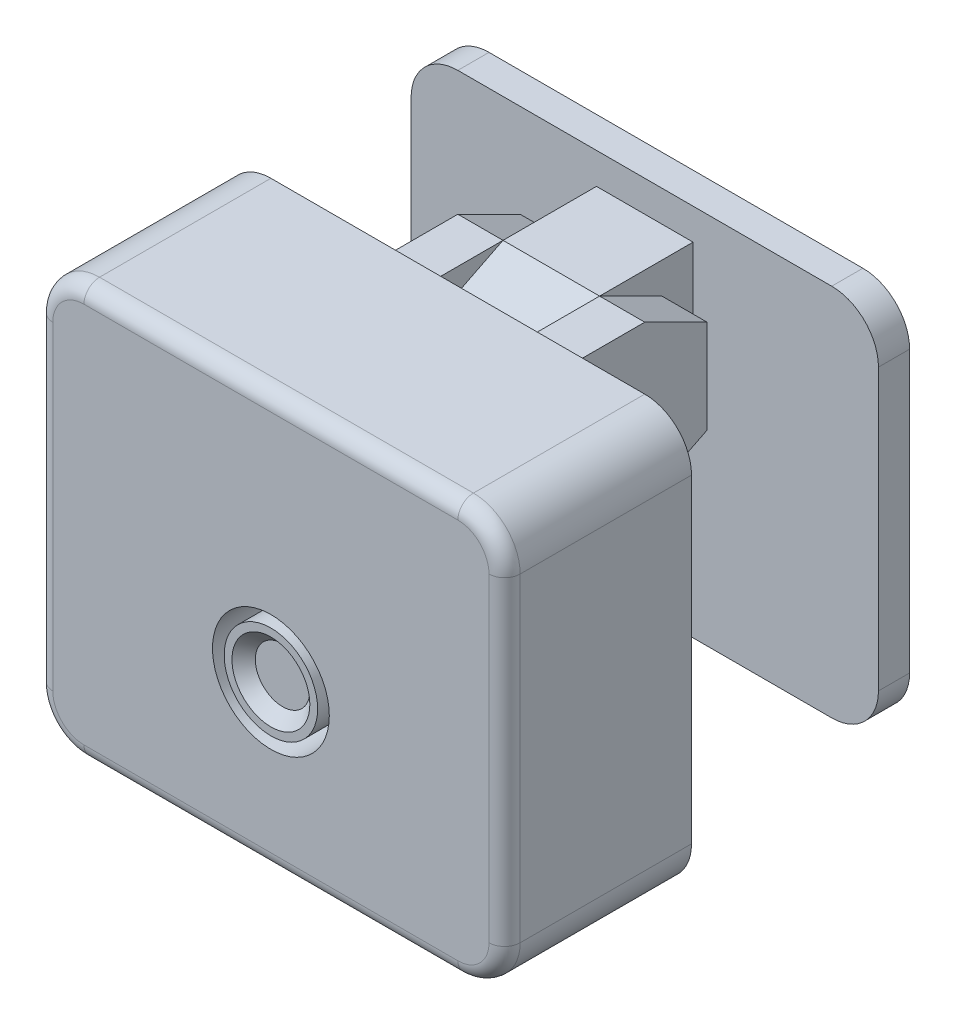
from build123d import *
from OCP.BRepFilletAPI import BRepFilletAPI_MakeChamfer

# Parameters (mm, degrees)
SKETCH1_W           = 30
SKETCH1_H           = 26.5
BOSS_EXTRUDE1_DEPTH = 12
FILLET1_R           = 3
FILLET2_R           = 1
SKETCH2_R           = 3.75
CUT_EXTRUDE1_DEPTH  = 5
SKETCH3_R           = 3
BOSS_EXTRUDE2_DEPTH = 5
SKETCH4_R           = 1.75
CUT_EXTRUDE2_DEPTH  = 0.75
CHAMFER1_SIZE       = 0.75
SKETCH5_W           = 2.9
SKETCH5_H           = 10
BOSS_EXTRUDE3_DEPTH = 10
CHAMFER2_SIZE       = 4
CHAMFER2_SIZE2      = 2
BOSS_EXTRUDE4_DEPTH = 6.2
SKETCH7_W           = 30
SKETCH7_H           = 24
BOSS_EXTRUDE5_DEPTH = 2
FILLET3_R           = 3
SKETCH8_W           = 11.5
SKETCH8_H           = 7.5
CUT_EXTRUDE3_DEPTH  = 5


with BuildPart() as part:
    # Sketch1 → Boss-Extrude1 (new body)
    with BuildSketch(Plane.XY):
        Rectangle(SKETCH1_W, SKETCH1_H)
    extrude(amount=BOSS_EXTRUDE1_DEPTH)

    # Fillet1
    fillet1_edges = [part.edges().sort_by_distance(p)[0] for p in [
        (-15, -13.25, 6),
        (15, -13.25, 6),
        (15, 13.25, 6),
        (-15, 13.25, 6),
    ]]
    fillet(fillet1_edges, radius=FILLET1_R)

    # Fillet2
    fillet2_edges = [part.edges().sort_by_distance(p)[0] for p in [
        (15, 0, 12),
        (0, -13.25, 12),
        (-15, 0, 12),
        (0, 13.25, 12),
        (-14.121320344, 12.371320344, 12),
        (14.121320344, 12.371320344, 12),
        (-14.121320344, -12.371320344, 12),
        (14.121320344, -12.371320344, 12),
    ]]
    fillet(fillet2_edges, radius=FILLET2_R)

    # Sketch2 → Cut-Extrude1 (cut)
    with BuildSketch(Plane.XY.offset(12)):
        with Locations((0, -2.75)):
            Circle(SKETCH2_R)
    extrude(amount=-CUT_EXTRUDE1_DEPTH, mode=Mode.SUBTRACT)

    # Sketch3 → Boss-Extrude2 (add)
    with BuildSketch(Plane.XY.offset(7)):
        with Locations((0, -2.75)):
            Circle(SKETCH3_R)
    extrude(amount=BOSS_EXTRUDE2_DEPTH)

    # Sketch4 → Cut-Extrude2 (cut)
    with BuildSketch(Plane.XY.offset(12)):
        with Locations((0, -2.75)):
            Circle(SKETCH4_R)
    extrude(amount=-CUT_EXTRUDE2_DEPTH, mode=Mode.SUBTRACT)

    # Chamfer1
    chamfer1_edges = [part.edges().sort_by_distance(p)[0] for p in [
        (-1.75, -2.75, 12),
    ]]
    chamfer(chamfer1_edges, length=CHAMFER1_SIZE - 0.0001)  # a hair under: the kernel refuses the full size

    # Sketch5 → Boss-Extrude3 (add)
    with BuildSketch(Plane(origin=(0, 0, 0), x_dir=(-1, 0, 0), z_dir=(0, 0, -1))):
        with Locations((-4.55, 6.25)):
            Rectangle(SKETCH5_W, SKETCH5_H)
        with Locations((4.55, 6.25)):
            Rectangle(SKETCH5_W, SKETCH5_H)
    extrude(amount=BOSS_EXTRUDE3_DEPTH)

    # Chamfer2: one chamfer whose edges measure the first distance from different faces: ONE call of the kernel's chamfer builder (chamfer() names one face for all edges)
    chamfer2_edges_1 = [part.edges().sort_by_distance(p)[0] for p in [
        (-4.55, 1.25, -10),
    ]]
    chamfer2_side_1 = [part.faces().sort_by_distance(p)[0] for p in [
        (-4.55, 1.25, -5),
    ]]
    chamfer2_edges_2 = [part.edges().sort_by_distance(p)[0] for p in [
        (4.55, 1.25, -10),
    ]]
    chamfer2_side_2 = [part.faces().sort_by_distance(p)[0] for p in [
        (4.55, 1.25, -5),
    ]]
    chamfer2_edges_3 = [part.edges().sort_by_distance(p)[0] for p in [
        (4.55, 11.25, -10),
    ]]
    chamfer2_side_3 = [part.faces().sort_by_distance(p)[0] for p in [
        (4.55, 11.25, -5),
    ]]
    chamfer2_edges_4 = [part.edges().sort_by_distance(p)[0] for p in [
        (-4.55, 11.25, -10),
    ]]
    chamfer2_side_4 = [part.faces().sort_by_distance(p)[0] for p in [
        (-4.55, 11.25, -5),
    ]]
    chamfer2 = BRepFilletAPI_MakeChamfer(part.part.solid().wrapped)
    for e in chamfer2_edges_1:
        chamfer2.Add(CHAMFER2_SIZE, CHAMFER2_SIZE2, e.wrapped, chamfer2_side_1[0].wrapped)  # the first distance lies on this face
    for e in chamfer2_edges_2:
        chamfer2.Add(CHAMFER2_SIZE, CHAMFER2_SIZE2, e.wrapped, chamfer2_side_2[0].wrapped)  # the first distance lies on this face
    for e in chamfer2_edges_3:
        chamfer2.Add(CHAMFER2_SIZE, CHAMFER2_SIZE2, e.wrapped, chamfer2_side_3[0].wrapped)  # the first distance lies on this face
    for e in chamfer2_edges_4:
        chamfer2.Add(CHAMFER2_SIZE, CHAMFER2_SIZE2, e.wrapped, chamfer2_side_4[0].wrapped)  # the first distance lies on this face
    add(Compound.cast(chamfer2.Shape()), mode=Mode.REPLACE)

    # Sketch6 → Boss-Extrude4 (add)
    with BuildSketch(Plane(origin=(-3.1, 0, 0), x_dir=(0, 0, -1), z_dir=(1, 0, 0))):
        Polygon((2, 9.25), (2, 3.25), (6, 1.25), (12, 1.25), (12, 11.25), (6, 11.25), align=None)
    extrude(amount=BOSS_EXTRUDE4_DEPTH)

    # Sketch7 → Boss-Extrude5 (add)
    with BuildSketch(Plane(origin=(0, 0, -12), x_dir=(-1, 0, 0), z_dir=(0, 0, -1))):
        with Locations((0, 1.25)):
            Rectangle(SKETCH7_W, SKETCH7_H)
    extrude(amount=BOSS_EXTRUDE5_DEPTH)

    # Fillet3
    fillet3_edges = [part.edges().sort_by_distance(p)[0] for p in [
        (-15, -10.75, -13),
        (-15, 13.25, -13),
        (15, 13.25, -13),
        (15, -10.75, -13),
    ]]
    fillet(fillet3_edges, radius=FILLET3_R)

    # Sketch8 → Cut-Extrude3 (cut)
    with BuildSketch(Plane(origin=(0, 0, 0), x_dir=(-1, 0, 0), z_dir=(0, 0, -1))):
        with Locations((5.75, -9.5)):
            Rectangle(SKETCH8_W, SKETCH8_H)
        with Locations((-5.75, -9.5)):
            Rectangle(SKETCH8_W, SKETCH8_H)
    extrude(amount=-CUT_EXTRUDE3_DEPTH, mode=Mode.SUBTRACT)


solid = part.part
